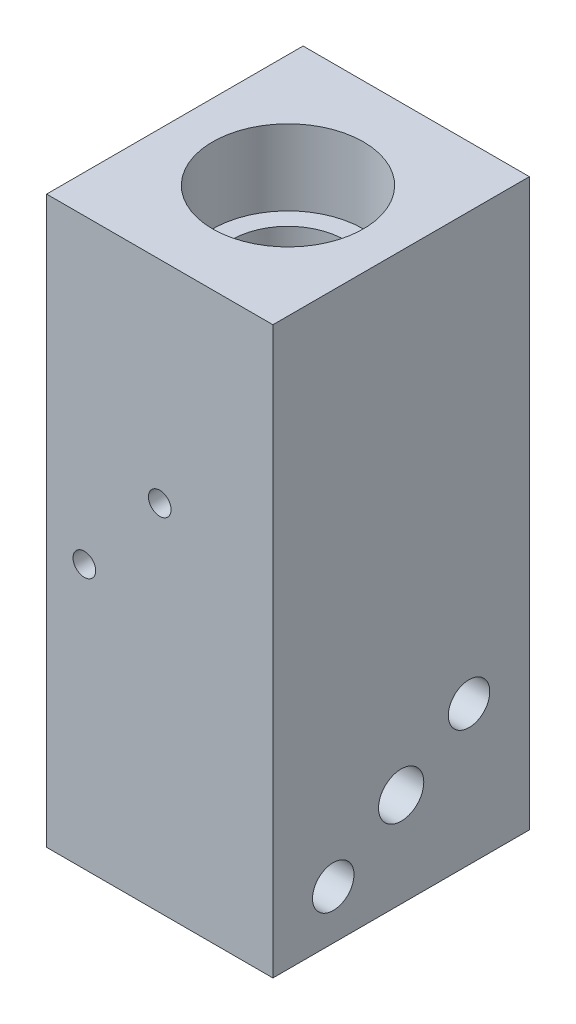
from build123d import *

# Parameters (mm, degrees)
SCHIZZO1_W                    = 30
SCHIZZO1_H                    = 75
ESTRUSIONE_ESTRUSIONE1_DEPTH  = 17
FORO_6_0_6_1_D                = 6
FORO_6_0_6_1_DEPTH            = 20
FORO_6_0_6_1_TIP              = 1.802581857
SCHIZZO6_R                    = 10
TAGLIO_ESTRUSIONE1_DEPTH      = 10
SCHIZZO7_R                    = 7.5
TAGLIO_ESTRUSIONE2_DEPTH      = 20
SCHIZZO8_R                    = 5
TAGLIO_ESTRUSIONE3_DEPTH      = 25
TAGLIO_ESTRUSIONE4_REACH      = 66.915
TAGLIO_ESTRUSIONE4_END_RADIUS = 3
SCHIZZO9_R                    = 1.5
TAGLIO_ESTRUSIONE5_REACH      = 84.547
TAGLIO_ESTRUSIONE5_END_RADIUS = 5
SCHIZZO10_R                   = 5
TAGLIO_ESTRUSIONE5_DRAFT      = -1
TAGLIO_ESTRUSIONE6_REACH      = 89.641
SCHIZZO11_R                   = 1.5


# Read off the part's stored shape, not the designer's step: Foro lamato per Vite M5 a testa cilindrica-1
with BuildPart() as part:
    # Schizzo1 → Estrusione-Estrusione1 (new, symmetric)
    with BuildSketch(Plane.XY):
        with Locations((15, 37.5)):
            Rectangle(SCHIZZO1_W, SCHIZZO1_H)
    extrude(amount=ESTRUSIONE_ESTRUSIONE1_DEPTH, both=True)

    # Foro Ø6.0 (6)-1
    with Locations(Plane(origin=(30, 12.5, 0), x_dir=(0, 0, 1), z_dir=(1, 0, 0))):
        with Locations((0, 0)):
            Hole(FORO_6_0_6_1_D / 2, depth=FORO_6_0_6_1_DEPTH)
            with Locations((0, 0, -(FORO_6_0_6_1_DEPTH + FORO_6_0_6_1_TIP / 2))):  # 118° drill point
                Cone(0, FORO_6_0_6_1_D / 2, FORO_6_0_6_1_TIP, mode=Mode.SUBTRACT)

    # Foro lamato per Vite M5 a testa cili 2 → Foro lamato per Vite M5 a testa cilindrica-1 (revolve, cut)
    with BuildSketch(Plane(origin=(0, 6.5, 9), x_dir=(0, 1, 0), z_dir=(0, 0, -1))):
        Polygon((2.75, 5.4), (2.75, 30), (0, 30), (0, 0), (5.025, 0), (5, 0.025), (5, 5.4), align=None)
    revolve(axis=Axis((0, 6.5, 9), (1, 0, 0)), mode=Mode.SUBTRACT)

    # Foro lamato per Vite M5 a testa cili 3 o → Foro lamato per Vite M5 a testa cili 3 (revolve, cut)
    with BuildSketch(Plane(origin=(0, 18.5, -9), x_dir=(0, 1, 0), z_dir=(0, 0, -1))):
        Polygon((0, 0), (5.025, 0), (5, 0.025), (5, 5.4), (2.75, 5.4), (2.75, 30), (0, 30), align=None)
    revolve(axis=Axis((0, 18.5, -9), (1, 0, 0)), mode=Mode.SUBTRACT)

    # Schizzo6 → Taglio-Estrusione1 (cut)
    with BuildSketch(Plane(origin=(0, 75, 0), x_dir=(1, 0, 0), z_dir=(0, 1, 0))):
        with Locations(Location((15, 0, 0), (0, 0, 270))):
            Circle(SCHIZZO6_R)
    extrude(amount=-TAGLIO_ESTRUSIONE1_DEPTH, mode=Mode.SUBTRACT)

    # Schizzo7 → Taglio-Estrusione2 (cut)
    with BuildSketch(Plane(origin=(0, 65, 0), x_dir=(1, 0, 0), z_dir=(0, 1, 0))):
        with Locations(Location((15, 0, 0), (0, 0, 270))):
            Circle(SCHIZZO7_R)
    extrude(amount=-TAGLIO_ESTRUSIONE2_DEPTH, mode=Mode.SUBTRACT)

    # Schizzo8 → Taglio-Estrusione3 (cut)
    with BuildSketch(Plane(origin=(0, 45, 0), x_dir=(1, 0, 0), z_dir=(0, 1, 0))):
        with Locations(Location((15, 0, 0), (0, 0, 270))):
            Circle(SCHIZZO8_R)
    extrude(amount=-TAGLIO_ESTRUSIONE3_DEPTH, mode=Mode.SUBTRACT)

    # Taglio-Estrusione4: up to this cylinder (the profile starts outside it)
    taglio_estrusione4_end = Plane(origin=(15, 12.5, 0), z_dir=(1, 0, 0)) * Cylinder(TAGLIO_ESTRUSIONE4_END_RADIUS, 140.83, mode=Mode.PRIVATE)
    # Schizzo9 → Taglio-Estrusione4 (cut, up to the surface)
    with BuildSketch(Plane(origin=(0, 20, 0), x_dir=(1, 0, 0), z_dir=(0, 1, 0)), mode=Mode.PRIVATE) as taglio_estrusione4_sk1:
        with Locations(Location((15, 0, 0), (0, 0, 270))):
            Circle(SCHIZZO9_R)
    taglio_estrusione4_tool1 = extrude(taglio_estrusione4_sk1.sketch, amount=-TAGLIO_ESTRUSIONE4_REACH, mode=Mode.PRIVATE) - taglio_estrusione4_end
    add(taglio_estrusione4_tool1.solids().sort_by_distance((15, 20, 0))[0], mode=Mode.SUBTRACT)

    # Taglio-Estrusione5: up to this cylinder (the profile starts outside it)
    taglio_estrusione5_end = Plane(origin=(15, 27, 0), z_dir=(0, 1, 0)) * Cylinder(TAGLIO_ESTRUSIONE5_END_RADIUS, 180.094, mode=Mode.PRIVATE)



with BuildPart() as taglio_estrusione5_long_prism_1:
    # Schizzo10 → Taglio-Estrusione5 (the long prism of profile 1, to be tilted and cut off)
    with BuildSketch(Plane.ZY):
        with Locations((0, 27)):
            Circle(SCHIZZO10_R)
    extrude(amount=-TAGLIO_ESTRUSIONE5_REACH)
    taglio_estrusione5_tool1_sides = [taglio_estrusione5_long_prism_1.faces().sort_by_distance(p)[0] for p in [
        (42.2735, 27, -5),
    ]]
    draft(taglio_estrusione5_tool1_sides, Plane.ZY, TAGLIO_ESTRUSIONE5_DRAFT)  # the draft: side faces tilted about the start plane


with BuildPart() as part_1:
    add(part.part)
    taglio_estrusione5_tool1 = taglio_estrusione5_long_prism_1.part - taglio_estrusione5_end
    add(taglio_estrusione5_tool1.solids().sort_by_distance((0, 27, 0))[0], mode=Mode.SUBTRACT)

    # Taglio-Estrusione6: up to this face of the body (flat: up to its plane)
    taglio_estrusione6_end = Plane(part_1.part.faces().sort_by_distance((15, 37.5, -17))[0])
    # Schizzo11 → Taglio-Estrusione6 (cut, up to the picked face)
    with BuildSketch(Plane.XY.offset(17), mode=Mode.PRIVATE) as taglio_estrusione6_sk1:
        with Locations((5, 35)):
            Circle(SCHIZZO11_R)
    taglio_estrusione6_tool1 = split(extrude(taglio_estrusione6_sk1.sketch, amount=-TAGLIO_ESTRUSIONE6_REACH, mode=Mode.PRIVATE), bisect_by=taglio_estrusione6_end, keep=Keep.BOTH, mode=Mode.PRIVATE)
    # Schizzo11 → Taglio-Estrusione6 (cut, up to the picked face)
    with BuildSketch(Plane.XY.offset(17), mode=Mode.PRIVATE) as taglio_estrusione6_sk2:
        with Locations((15, 47)):
            Circle(SCHIZZO11_R)
    taglio_estrusione6_tool2 = split(extrude(taglio_estrusione6_sk2.sketch, amount=-TAGLIO_ESTRUSIONE6_REACH, mode=Mode.PRIVATE), bisect_by=taglio_estrusione6_end, keep=Keep.BOTH, mode=Mode.PRIVATE)
    add(taglio_estrusione6_tool1.solids().sort_by(Axis((5, 35, 17), (0, 0, -1)))[0], mode=Mode.SUBTRACT)
    add(taglio_estrusione6_tool2.solids().sort_by(Axis((15, 47, 17), (0, 0, -1)))[0], mode=Mode.SUBTRACT)


solid = part_1.part
